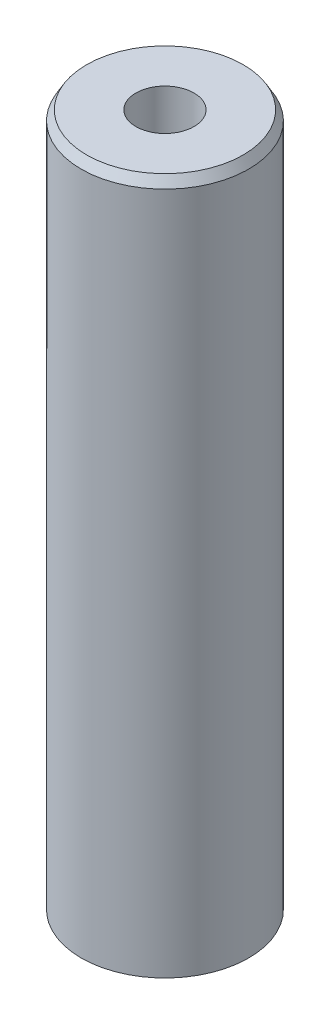
from build123d import *
from OCP.BRepFilletAPI import BRepFilletAPI_MakeChamfer

# Parameters (mm, degrees)
SKETCH1_R           = 20
BOSS_EXTRUDE1_DEPTH = 166.703919227
SKETCH2_R           = 6.945348901
CUT_EXTRUDE1_DEPTH  = 170.086358663
CHAMFER1_SIZE       = 2.271928003
CHAMFER1_SIZE2      = 1.311698244


with BuildPart() as part:
    # Sketch1 → Boss-Extrude1 (new body)
    with BuildSketch(Plane(origin=(0, 0, 0), x_dir=(1, 0, 0), z_dir=(0, 1, 0))):
        Circle(SKETCH1_R)
    extrude(amount=BOSS_EXTRUDE1_DEPTH)

    # Sketch2 → Cut-Extrude1 (cut, through all)
    with BuildSketch(Plane(origin=(0, 0, 0), x_dir=(1, 0, 0), z_dir=(0, 1, 0))):
        Circle(SKETCH2_R)
    extrude(amount=CUT_EXTRUDE1_DEPTH, mode=Mode.SUBTRACT)

    # Chamfer1: one chamfer whose edges measure the first distance from different faces: ONE call of the kernel's chamfer builder (chamfer() names one face for all edges)
    chamfer1_edges_1 = [part.edges().sort_by_distance(p)[0] for p in [
        (-20, 166.703919227, 0),
    ]]
    chamfer1_side_1 = [part.faces().sort_by_distance(p)[0] for p in [
        (-20, 83.351959614, 0),
    ]]
    chamfer1_edges_2 = [part.edges().sort_by_distance(p)[0] for p in [
        (-20, 0, 0),
    ]]
    chamfer1_side_2 = [part.faces().sort_by_distance(p)[0] for p in [
        (-19.434314575, 0, 0),
    ]]
    chamfer1 = BRepFilletAPI_MakeChamfer(part.part.solid().wrapped)
    for e in chamfer1_edges_1:
        chamfer1.Add(CHAMFER1_SIZE, CHAMFER1_SIZE2, e.wrapped, chamfer1_side_1[0].wrapped)  # the first distance lies on this face
    for e in chamfer1_edges_2:
        chamfer1.Add(CHAMFER1_SIZE, CHAMFER1_SIZE2, e.wrapped, chamfer1_side_2[0].wrapped)  # the first distance lies on this face
    add(Compound.cast(chamfer1.Shape()), mode=Mode.REPLACE)


solid = part.part
